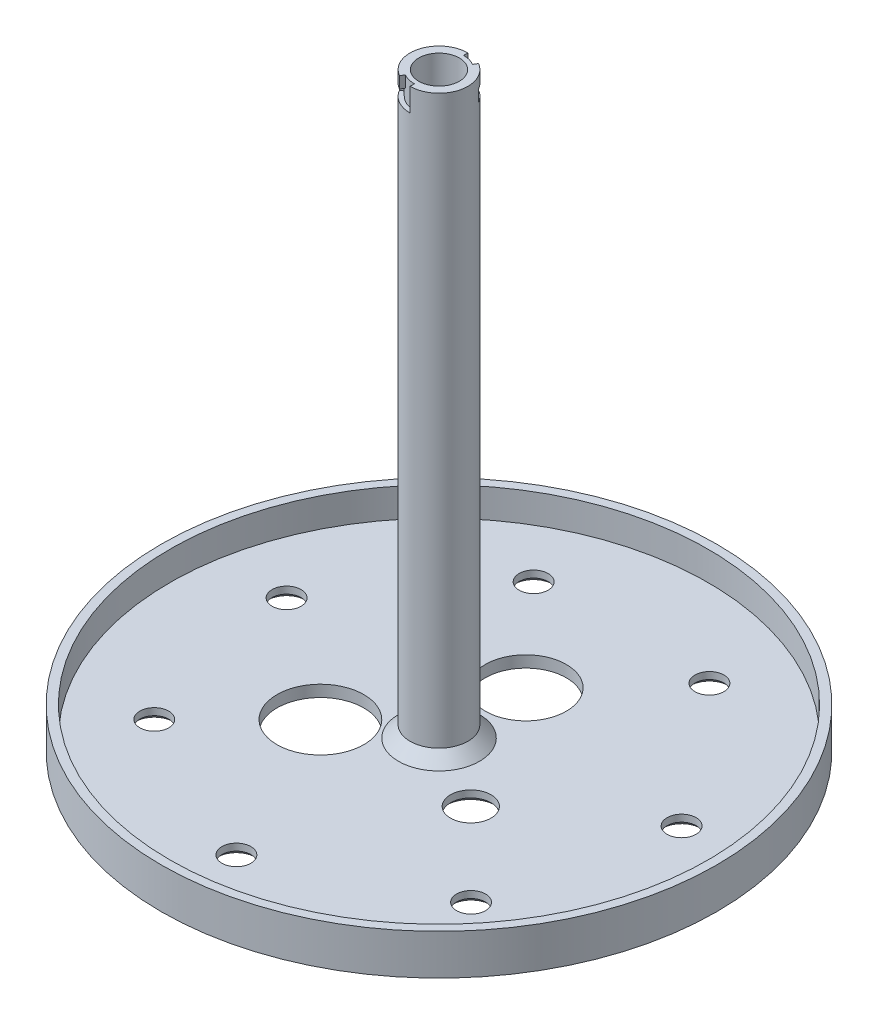
from build123d import *

# Parameters (mm, degrees)
SKETCH1_R                = 46.5
SKETCH1_R_2              = 7
SKETCH1_R_3              = 7.5
SKETCH1_R_4              = 3.5
BOSS_EXTRUDE1_DEPTH      = 2
SKETCH3_R                = 5
SKETCH3_R_2              = 3.5
BOSS_EXTRUDE2_DEPTH      = 100
CUT_EXTRUDE2_REACH       = 123.361
SKETCH6_R                = 2.5
CHAMFER2_SIZE            = 0.8
SKETCH7_W                = 0.75
SKETCH7_H                = 2
CUT_REVOLVE1_ANGLE       = 30
SKETCH7_4_W              = 0.75
SKETCH7_4_H              = 2
CUT_REVOLVE2_ANGLE       = 60
CIRPATTERN5_COUNT        = 2
BOSS_EXTRUDE3_DEPTH      = 5
BOSS_EXTRUDE3_DEPTH_BACK = 2
SKETCH8_R                = 48
SKETCH8_R_2              = 46.5
CHAMFER3_SIZE            = 2


with BuildPart() as part:
    # Sketch1 → Boss-Extrude1 (new body)
    with BuildSketch(Plane(origin=(0, 0, 0), x_dir=(1, 0, 0), z_dir=(0, 1, 0))):
        Circle(SKETCH1_R)
        with Locations((0, 15)):
            Circle(SKETCH1_R_2, mode=Mode.SUBTRACT)
        with Locations((-12.990381057, -7.5)):
            Circle(SKETCH1_R_3, mode=Mode.SUBTRACT)
        with Locations((12.990381057, -7.5)):
            Circle(SKETCH1_R_4, mode=Mode.SUBTRACT)
        Circle(SKETCH1_R_4, mode=Mode.SUBTRACT)
    extrude(amount=BOSS_EXTRUDE1_DEPTH)

    # Sketch3 → Boss-Extrude2 (add)
    with BuildSketch(Plane(origin=(0, 2, 0), x_dir=(1, 0, 0), z_dir=(0, 1, 0))):
        Circle(SKETCH3_R)
        Circle(SKETCH3_R_2, mode=Mode.SUBTRACT)
    extrude(amount=BOSS_EXTRUDE2_DEPTH)

    # Sketch6 → Cut-Extrude2 (cut, up to next)
    with BuildSketch(Plane.XZ, mode=Mode.PRIVATE) as cut_extrude2_sk1:
        with Locations((27.364101886, 21.822143065)):
            Circle(SKETCH6_R)
    cut_extrude2_tool1 = extrude(cut_extrude2_sk1.sketch, amount=-CUT_EXTRUDE2_REACH, mode=Mode.PRIVATE) & part.part
    # Sketch6 → Cut-Extrude2 (cut, up to next)
    with BuildSketch(Plane.XZ, mode=Mode.PRIVATE) as cut_extrude2_sk2:
        with Locations((34.122476926, -7.788232688)):
            Circle(SKETCH6_R)
    cut_extrude2_tool2 = extrude(cut_extrude2_sk2.sketch, amount=-CUT_EXTRUDE2_REACH, mode=Mode.PRIVATE) & part.part
    # Sketch6 → Cut-Extrude2 (cut, up to next)
    with BuildSketch(Plane.XZ, mode=Mode.PRIVATE) as cut_extrude2_sk3:
        with Locations((0, 35)):
            Circle(SKETCH6_R)
    cut_extrude2_tool3 = extrude(cut_extrude2_sk3.sketch, amount=-CUT_EXTRUDE2_REACH, mode=Mode.PRIVATE) & part.part
    # Sketch6 → Cut-Extrude2 (cut, up to next)
    with BuildSketch(Plane.XZ, mode=Mode.PRIVATE) as cut_extrude2_sk4:
        with Locations((15.185930869, -31.533910377)):
            Circle(SKETCH6_R)
    cut_extrude2_tool4 = extrude(cut_extrude2_sk4.sketch, amount=-CUT_EXTRUDE2_REACH, mode=Mode.PRIVATE) & part.part
    # Sketch6 → Cut-Extrude2 (cut, up to next)
    with BuildSketch(Plane.XZ, mode=Mode.PRIVATE) as cut_extrude2_sk5:
        with Locations((-27.364101886, 21.822143065)):
            Circle(SKETCH6_R)
    cut_extrude2_tool5 = extrude(cut_extrude2_sk5.sketch, amount=-CUT_EXTRUDE2_REACH, mode=Mode.PRIVATE) & part.part
    # Sketch6 → Cut-Extrude2 (cut, up to next)
    with BuildSketch(Plane.XZ, mode=Mode.PRIVATE) as cut_extrude2_sk6:
        with Locations((-15.185930869, -31.533910377)):
            Circle(SKETCH6_R)
    cut_extrude2_tool6 = extrude(cut_extrude2_sk6.sketch, amount=-CUT_EXTRUDE2_REACH, mode=Mode.PRIVATE) & part.part
    # Sketch6 → Cut-Extrude2 (cut, up to next)
    with BuildSketch(Plane.XZ, mode=Mode.PRIVATE) as cut_extrude2_sk7:
        with Locations((-34.122476926, -7.788232688)):
            Circle(SKETCH6_R)
    cut_extrude2_tool7 = extrude(cut_extrude2_sk7.sketch, amount=-CUT_EXTRUDE2_REACH, mode=Mode.PRIVATE) & part.part
    add(cut_extrude2_tool1.solids().sort_by_distance((27.364102, 0, 21.822143))[0], mode=Mode.SUBTRACT)
    add(cut_extrude2_tool2.solids().sort_by_distance((34.122477, 0, -7.788233))[0], mode=Mode.SUBTRACT)
    add(cut_extrude2_tool3.solids().sort_by_distance((0, 0, 35))[0], mode=Mode.SUBTRACT)
    add(cut_extrude2_tool4.solids().sort_by_distance((15.185931, 0, -31.53391))[0], mode=Mode.SUBTRACT)
    add(cut_extrude2_tool5.solids().sort_by_distance((-27.364102, 0, 21.822143))[0], mode=Mode.SUBTRACT)
    add(cut_extrude2_tool6.solids().sort_by_distance((-15.185931, 0, -31.53391))[0], mode=Mode.SUBTRACT)
    add(cut_extrude2_tool7.solids().sort_by_distance((-34.122477, 0, -7.788233))[0], mode=Mode.SUBTRACT)

    # Chamfer2
    chamfer2_edges = [part.edges().sort_by_distance(p)[0] for p in [
        (-2.5, 0, 35),
        (-29.864101886, 0, 21.822143065),
        (-36.622476926, 0, -7.788232688),
        (-17.685930869, 0, -31.533910377),
        (24.864101886, 0, 21.822143065),
        (9.490381057, 0, 7.5),
        (31.622476926, 0, -7.788232688),
        (12.685930869, 0, -31.533910377),
    ]]
    chamfer(chamfer2_edges, length=CHAMFER2_SIZE)

    # Sketch7 → Cut-Revolve1 (revolve, cut)
    with BuildSketch(Plane(origin=(0, 0, 0), x_dir=(0, 0, -1), z_dir=(1, 0, 0))):
        with Locations((4.625, 101)):
            Rectangle(SKETCH7_W, SKETCH7_H)
    cut_revolve1 = revolve(axis=Axis((0, 102, 0), (0, -1, 0)), revolution_arc=CUT_REVOLVE1_ANGLE, mode=Mode.SUBTRACT)

    # Sketch7<4> → Cut-Revolve2 (revolve, cut)
    with BuildSketch(Plane(origin=(0, 0, 0), x_dir=(0, 0, -1), z_dir=(1, 0, 0))):
        with Locations((4.625, 99)):
            Rectangle(SKETCH7_4_W, SKETCH7_4_H)
    cut_revolve2 = revolve(axis=Axis((0, 102, 0), (0, -1, 0)), revolution_arc=CUT_REVOLVE2_ANGLE, mode=Mode.SUBTRACT)

    # CirPattern5: Cut-Revolve1, Cut-Revolve2 ×2 about axis
    cirpattern5_axis = Axis((0, 102, 0), (0, -1, 0))
    add([cut_revolve1.rotate(cirpattern5_axis, i * 360 / CIRPATTERN5_COUNT) for i in range(1, CIRPATTERN5_COUNT)], mode=Mode.SUBTRACT)
    add([cut_revolve2.rotate(cirpattern5_axis, i * 360 / CIRPATTERN5_COUNT) for i in range(1, CIRPATTERN5_COUNT)], mode=Mode.SUBTRACT)

    # Chamfer3
    chamfer3_edges = [part.edges().sort_by_distance(p)[0] for p in [
        (-5, 2, 0),
    ]]
    chamfer(chamfer3_edges, length=CHAMFER3_SIZE)


with BuildPart() as body_2:
    # Sketch8 → Boss-Extrude3 (new, two sides: drawn at the far end of the back side and taken through both)
    with BuildSketch(Plane(origin=(0, 2, 0), x_dir=(1, 0, 0), z_dir=(0, 1, 0)).offset(-BOSS_EXTRUDE3_DEPTH_BACK)):
        Circle(SKETCH8_R)
        Circle(SKETCH8_R_2, mode=Mode.SUBTRACT)
    extrude(amount=BOSS_EXTRUDE3_DEPTH + BOSS_EXTRUDE3_DEPTH_BACK)


solid = Compound([part.part, body_2.part])
